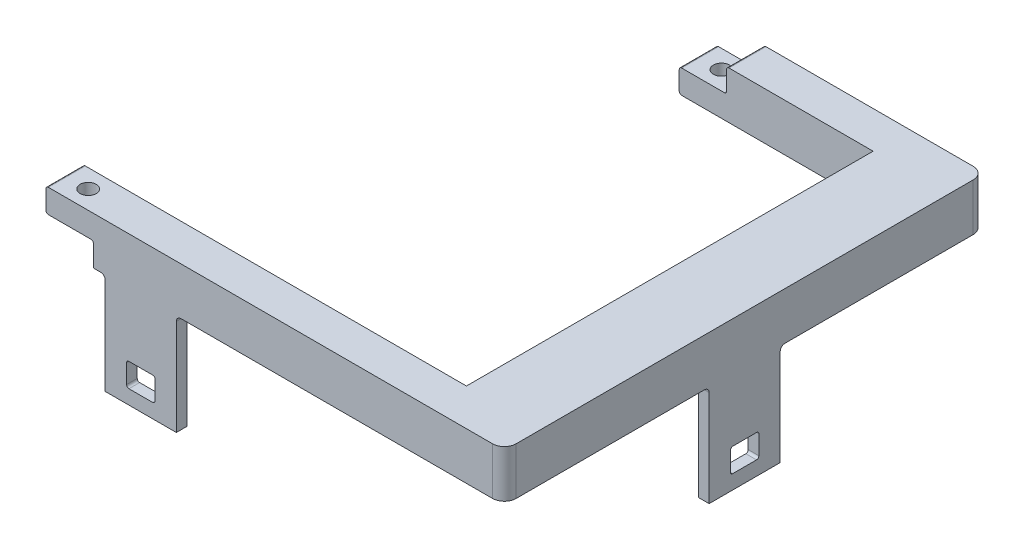
from build123d import *

# Parameters (mm, degrees)
SKETCH1_W            = 153.4
SKETCH1_H            = 101.4
BOSS_EXTRUDE1_DEPTH  = 10
SKETCH2_W            = 121.8
SKETCH2_H            = 85.8
CUT_EXTRUDE1_DEPTH   = 93.484485185
CUT_EXTRUDE2_DEPTH   = 93.484485185
SKETCH4_W            = 2.25
SKETCH4_H            = 15
SKETCH4_W_2          = 15
SKETCH4_H_2          = 2.25
BOSS_EXTRUDE2_DEPTH  = 21.3
SKETCH5_W            = 6
SKETCH5_H            = 5
CUT_EXTRUDE3_DEPTH   = 112.243291933
SKETCH6_W            = 6
SKETCH6_H            = 5
CUT_EXTRUDE4_DEPTH   = 129.912916343
M3_CLEARANCE_HOLE1_D = 3.4
SKETCH10_W           = 10
SKETCH10_H           = 5
CUT_EXTRUDE5_DEPTH   = 129.912916343
CUT_EXTRUDE6_REACH   = 130.913
SKETCH11_W           = 10
SKETCH11_H           = 5
FILLET1_R            = 2.5
FILLET2_R            = 0.5
FILLET5_R            = 0.5
FILLET6_R            = 1
FILLET7_R            = 0.5


with BuildPart() as part:
    # Sketch1 → Boss-Extrude1 (new body)
    with BuildSketch(Plane(origin=(0, 0, 0), x_dir=(1, 0, 0), z_dir=(0, 1, 0))):
        Rectangle(SKETCH1_W, SKETCH1_H)
    extrude(amount=BOSS_EXTRUDE1_DEPTH)

    # Sketch2 → Cut-Extrude1 (cut, through all)
    with BuildSketch(Plane.XZ):
        Rectangle(SKETCH2_W, SKETCH2_H)
    extrude(amount=-CUT_EXTRUDE1_DEPTH, mode=Mode.SUBTRACT)

    # Sketch3 → Cut-Extrude2 (cut, through all)
    with BuildSketch(Plane.XZ):
        Polygon((-20, 50.7), (-20, 42.9), (-60.9, 42.9), (-60.9, -42.9), (20, -42.9), (20, -50.7), (-76.7, -50.7), (-76.7, 50.7), align=None)
    extrude(amount=-CUT_EXTRUDE2_DEPTH, mode=Mode.SUBTRACT)

    # Sketch4 → Boss-Extrude2 (add)
    with BuildSketch(Plane.XZ):
        with Locations((75.575, 0)):
            Rectangle(SKETCH4_W, SKETCH4_H)
        with Locations((0, 49.575)):
            Rectangle(SKETCH4_W_2, SKETCH4_H_2)
    extrude(amount=BOSS_EXTRUDE2_DEPTH)

    # Sketch5 → Cut-Extrude3 (cut, through all)
    with BuildSketch(Plane(origin=(76.7, 0, 0), x_dir=(0, 0, -1), z_dir=(1, 0, 0))):
        with Locations((0, -15.8)):
            Rectangle(SKETCH5_W, SKETCH5_H)
    extrude(amount=-CUT_EXTRUDE3_DEPTH, mode=Mode.SUBTRACT)

    # Sketch6 → Cut-Extrude4 (cut, through all)
    with BuildSketch(Plane.XY.offset(50.7)):
        with Locations((0, -15.8)):
            Rectangle(SKETCH6_W, SKETCH6_H)
    extrude(amount=-CUT_EXTRUDE4_DEPTH, mode=Mode.SUBTRACT)

    # M3 Clearance Hole1 (through all)
    with Locations(Plane(origin=(0, 10, 0), x_dir=(1, 0, 0), z_dir=(0, 1, 0))):
        with Locations((-15, -46.8), (25, 46.8)):
            Hole(M3_CLEARANCE_HOLE1_D / 2)

    # Sketch10 → Cut-Extrude5 (cut, through all)
    with BuildSketch(Plane.XY.offset(50.7)):
        with Locations((-15, 2.5)):
            Rectangle(SKETCH10_W, SKETCH10_H)
    extrude(amount=-CUT_EXTRUDE5_DEPTH, mode=Mode.SUBTRACT)

    # Sketch11 → Cut-Extrude6 (cut, up to next)
    with BuildSketch(Plane(origin=(0, 0, -50.7), x_dir=(-1, 0, 0), z_dir=(0, 0, -1)), mode=Mode.PRIVATE) as cut_extrude6_sk1:
        with Locations((-25, 7.5)):
            Rectangle(SKETCH11_W, SKETCH11_H)
    cut_extrude6_tool1 = extrude(cut_extrude6_sk1.sketch, amount=-CUT_EXTRUDE6_REACH, mode=Mode.PRIVATE) & part.part
    add(cut_extrude6_tool1.solids().sort_by_distance((25, 7.5, -50.7))[0], mode=Mode.SUBTRACT)

    # Fillet1
    fillet1_edges = [part.edges().sort_by_distance(p)[0] for p in [
        (76.7, 5, -50.7),
        (76.7, 5, 50.7),
    ]]
    fillet(fillet1_edges, radius=FILLET1_R)

    # Fillet2
    fillet2_edges = [part.edges().sort_by_distance(p)[0] for p in [
        (-20, 10, 46.8),
        (20, 0, -46.8),
        (30, 5, -46.8),
        (30, 10, -46.8),
        (20, 5, -46.8),
    ]]
    fillet(fillet2_edges, radius=FILLET2_R)

    # Fillet5
    fillet5_edges = [part.edges().sort_by_distance(p)[0] for p in [
        (-20, 5, 46.8),
        (-10, 5, 46.8),
    ]]
    fillet(fillet5_edges, radius=FILLET5_R)

    # Fillet6
    fillet6_edges = [part.edges().sort_by_distance(p)[0] for p in [
        (75.575, 0, -7.5),
        (75.575, 0, 7.5),
        (74.45, 0, 0),
        (-7.5, 0, 49.575),
        (7.5, 0, 49.575),
        (0, 0, 48.45),
    ]]
    fillet(fillet6_edges, radius=FILLET6_R)

    # Fillet7
    fillet7_edges = [part.edges().sort_by_distance(p)[0] for p in [
        (75.575, -18.3, 3),
        (75.575, -13.3, 3),
        (75.575, -13.3, -3),
        (75.575, -18.3, -3),
        (-3, -13.3, 49.575),
        (3, -13.3, 49.575),
        (-3, -18.3, 49.575),
        (3, -18.3, 49.575),
    ]]
    fillet(fillet7_edges, radius=FILLET7_R)


solid = part.part
